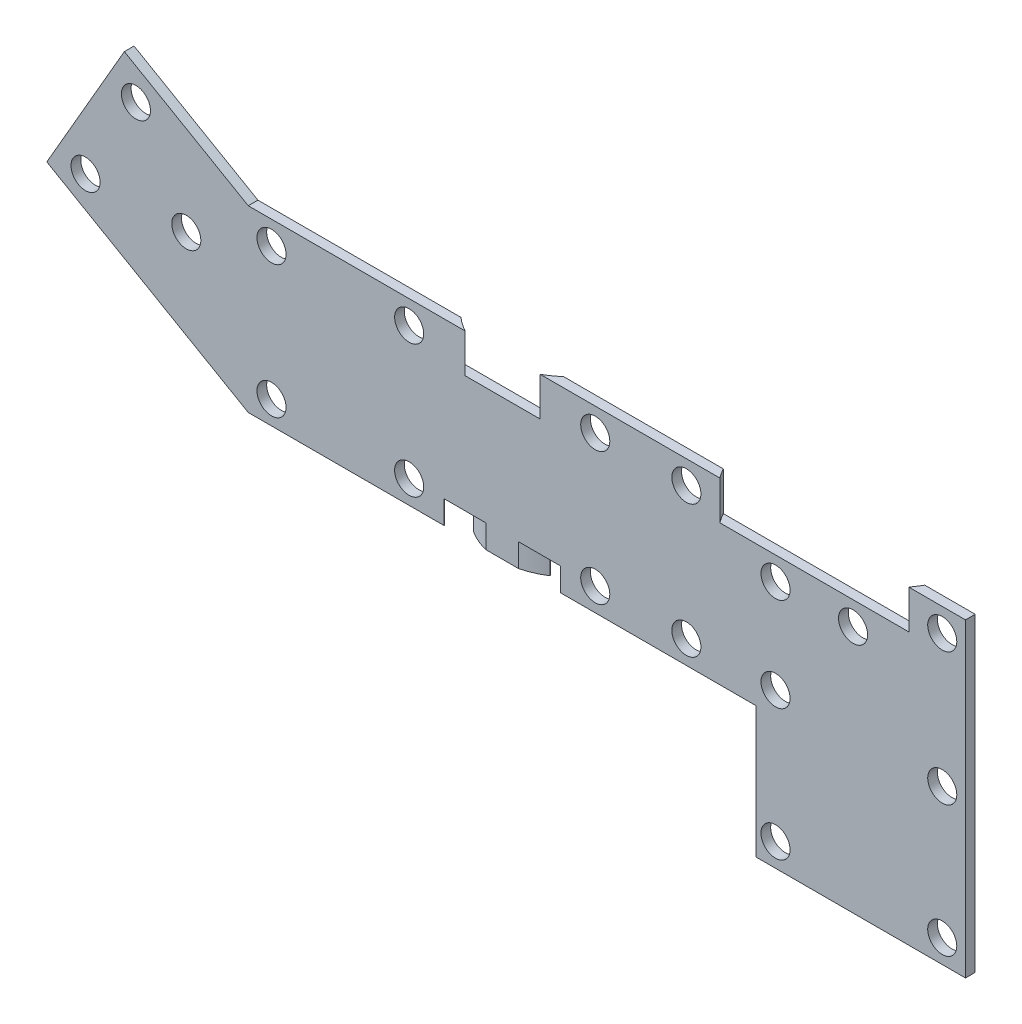
from build123d import *

# Parameters (mm, degrees)
SKETCH1_R           = 4.7625
BOSS_EXTRUDE1_DEPTH = 3.175
SKETCH2_R           = 29.21
SKETCH2_R_2         = 22.86
CUT_EXTRUDE1_DEPTH  = 7.62
SKETCH5_R           = 38.1
SKETCH5_R_2         = 25.4
CUT_EXTRUDE5_DEPTH  = 12.7


with BuildPart() as part:
    # Sketch1 → Boss-Extrude1 (new body)
    with BuildSketch(Plane.XY):
        Polygon((234.95, 0), (0, 0), (-40.591135768, 23.435303163), (-65.991135768, -20.55878735), (0, -58.65878735), (64.135, -58.65878735), (64.135, -51.03878735), (70.612, -51.03878735), (70.612, -58.65878735), (95.758, -58.65878735), (95.758, -51.03878735), (102.235, -51.03878735), (102.235, -58.65878735), (166.37, -58.65878735), (166.37, -101.6), (234.95, -101.6), align=None)
        with Locations((7.62, -51.03878735)):
            Circle(SKETCH1_R, mode=Mode.SUBTRACT)
        with Locations((52.705, -51.03878735)):
            Circle(SKETCH1_R, mode=Mode.SUBTRACT)
        with Locations((172.72, -93.98)):
            Circle(SKETCH1_R, mode=Mode.SUBTRACT)
        with Locations((227.33, -93.98)):
            Circle(SKETCH1_R, mode=Mode.SUBTRACT)
        with Locations((113.665, -51.03878735)):
            Circle(SKETCH1_R, mode=Mode.SUBTRACT)
        with Locations((143.51, -51.03878735)):
            Circle(SKETCH1_R, mode=Mode.SUBTRACT)
        with Locations((172.72, -51.03878735)):
            Circle(SKETCH1_R, mode=Mode.SUBTRACT)
        with Locations((227.33, -51.03878735)):
            Circle(SKETCH1_R, mode=Mode.SUBTRACT)
        with Locations((-53.291135768, -17.611742094)):
            Circle(SKETCH1_R, mode=Mode.SUBTRACT)
        with Locations((-20.295567884, -17.611742094)):
            Circle(SKETCH1_R, mode=Mode.SUBTRACT)
        with Locations((7.62, -7.62)):
            Circle(SKETCH1_R, mode=Mode.SUBTRACT)
        with Locations((-36.793351826, 10.963257906)):
            Circle(SKETCH1_R, mode=Mode.SUBTRACT)
        with Locations((52.705, -7.62)):
            Circle(SKETCH1_R, mode=Mode.SUBTRACT)
        with Locations((172.72, -20.32)):
            Circle(SKETCH1_R, mode=Mode.SUBTRACT)
        with Locations((198.12, -20.32)):
            Circle(SKETCH1_R, mode=Mode.SUBTRACT)
        with Locations((113.665, -7.62)):
            Circle(SKETCH1_R, mode=Mode.SUBTRACT)
        with Locations((143.51, -7.62)):
            Circle(SKETCH1_R, mode=Mode.SUBTRACT)
        with Locations((227.33, -7.62)):
            Circle(SKETCH1_R, mode=Mode.SUBTRACT)
    extrude(amount=BOSS_EXTRUDE1_DEPTH)

    # Sketch2 → Cut-Extrude1 (cut)
    with BuildSketch(Plane.XZ.offset(58.65878735)):
        with Locations((83.185, -19.05)):
            Circle(SKETCH2_R)
        with Locations((83.185, -19.05)):
            Circle(SKETCH2_R_2, mode=Mode.SUBTRACT)
    extrude(amount=-CUT_EXTRUDE1_DEPTH, mode=Mode.SUBTRACT)

    # Sketch5 → Cut-Extrude5 (cut)
    with BuildSketch(Plane(origin=(0, 0, 0), x_dir=(1, 0, 0), z_dir=(0, 1, 0))):
        with Locations((185.42, 19.05)):
            Circle(SKETCH5_R)
        with Locations((83.312, 19.05)):
            Circle(SKETCH5_R_2)
    extrude(amount=-CUT_EXTRUDE5_DEPTH, mode=Mode.SUBTRACT)


solid = part.part
